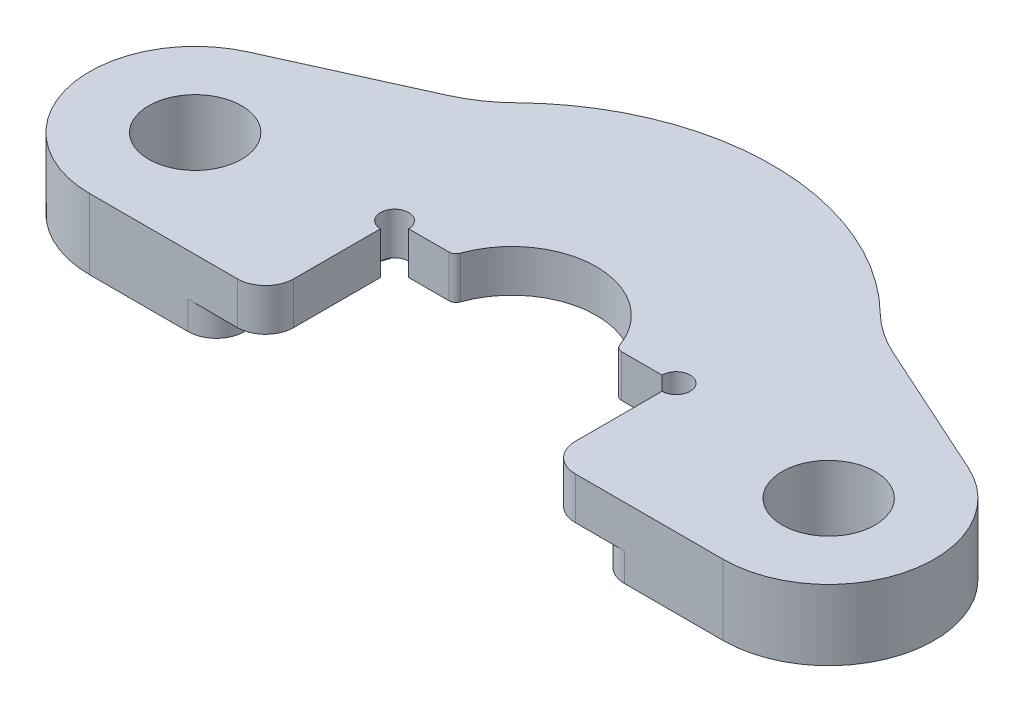
from build123d import *

# Parameters (mm, degrees)
BOSS_EXTRUDE1_DEPTH  = 5
CUT_EXTRUDE1_DEPTH   = 36.598455023
FILLET1_R            = 10
M6_CLEARANCE_HOLE1_D = 6.6
FILLET2_R            = 0.5
SKETCH5_R            = 1
CUT_EXTRUDE2_DEPTH   = 36.598455023
FILLET3_R            = 2
CUT_EXTRUDE3_DEPTH   = 2
FILLET4_R            = 2


with BuildPart() as part:
    # Sketch1 → Boss-Extrude1 (new body)
    with BuildSketch(Plane(origin=(0, 0, 0), x_dir=(1, 0, 0), z_dir=(0, 1, 0))):
        with BuildLine():
            Line((-25.590540252, 6.833634535), (-14.025260906, 12.064081255))
            ThreePointArc((-14.025260906, 12.064081255), (0, 18.5), (14.025260906, 12.064081255))
            Line((14.025260906, 12.064081255), (25.590540252, 6.833634535))
            ThreePointArc((25.590540252, 6.833634535), (29.83151618, -1.580781609), (22.5, -7.5))
            Line((22.5, -7.5), (-22.5, -7.5))
            ThreePointArc((-22.5, -7.5), (-29.83151618, -1.580781609), (-25.590540252, 6.833634535))
        make_face()
    extrude(amount=BOSS_EXTRUDE1_DEPTH)

    # Sketch2 → Cut-Extrude1 (cut, through all)
    with BuildSketch(Plane(origin=(0, 5, 0), x_dir=(1, 0, 0), z_dir=(0, 1, 0))):
        with BuildLine():
            Line((10, -7.5), (10, 1.661480829))
            Line((10, 1.661480829), (5.765369152, 1.661480829))
            ThreePointArc((5.765369152, 1.661480829), (0, 6), (-5.765369152, 1.661480829))
            Line((-5.765369152, 1.661480829), (-10, 1.661480829))
            Line((-10, 1.661480829), (-10, -7.5))
            Line((-10, -7.5), (10, -7.5))
        make_face()
    extrude(amount=-CUT_EXTRUDE1_DEPTH, mode=Mode.SUBTRACT)

    # Fillet1
    fillet1_edges = [part.edges().sort_by_distance(p)[0] for p in [
        (-14.025260906, 2.5, -12.064081255),
        (14.025260906, 2.5, -12.064081255),
    ]]
    fillet(fillet1_edges, radius=FILLET1_R)

    # M6 Clearance Hole1 (through all)
    with Locations(Plane(origin=(0, 5, 0), x_dir=(1, 0, 0), z_dir=(0, 1, 0))):
        with Locations((-22.5, 0), (22.5, 0)):
            Hole(M6_CLEARANCE_HOLE1_D / 2)

    # Fillet2
    fillet2_edges = [part.edges().sort_by_distance(p)[0] for p in [
        (5.765369152, 2.5, -1.661480829),
        (-5.765369152, 2.5, -1.661480829),
    ]]
    fillet(fillet2_edges, radius=FILLET2_R)

    # Sketch5 → Cut-Extrude2 (cut, through all)
    with BuildSketch(Plane(origin=(0, 5, 0), x_dir=(1, 0, 0), z_dir=(0, 1, 0))):
        with Locations((-10, 1.661480829)):
            Circle(SKETCH5_R)
        with Locations((10, 1.661480829)):
            Circle(SKETCH5_R)
    extrude(amount=-CUT_EXTRUDE2_DEPTH, mode=Mode.SUBTRACT)

    # Fillet3
    fillet3_edges = [part.edges().sort_by_distance(p)[0] for p in [
        (10, 2.5, 7.5),
        (-10, 2.5, 7.5),
    ]]
    fillet(fillet3_edges, radius=FILLET3_R)

    # Sketch6 → Cut-Extrude3 (cut)
    with BuildSketch(Plane.XZ):
        with BuildLine():
            Line((-13.5, 0), (-13.5, 12))
            ThreePointArc((-13.5, 12), (0, 25.5), (13.5, 12))
            Line((13.5, 12), (13.5, 0))
            ThreePointArc((13.5, 0), (0, -13.5), (-13.5, 0))
        make_face()
    extrude(amount=-CUT_EXTRUDE3_DEPTH, mode=Mode.SUBTRACT)

    # Fillet4
    fillet4_edges = [part.edges().sort_by_distance(p)[0] for p in [
        (-13.5, 1, 7.5),
        (13.5, 1, 7.5),
    ]]
    fillet(fillet4_edges, radius=FILLET4_R)


solid = part.part
